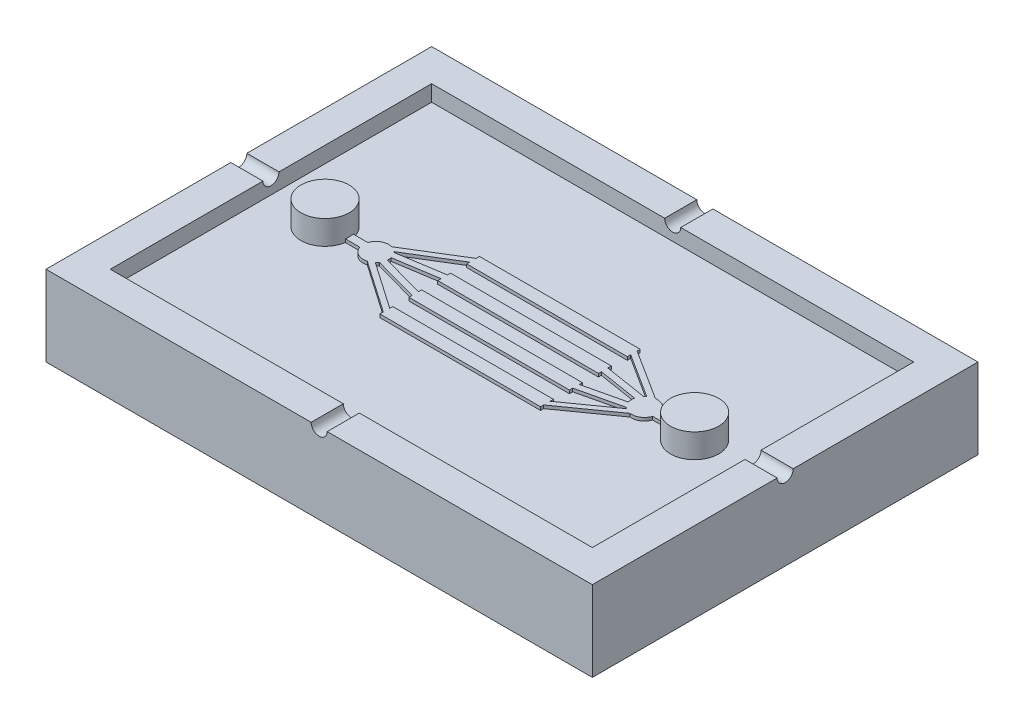
from build123d import *

# Parameters (mm, degrees)
CROQUIS1_W               = 34
CROQUIS1_H               = 24
SALIENTE_EXTRUIR1_DEPTH  = 3
CROQUIS2_W               = 30
CROQUIS2_H               = 20
CORTAR_EXTRUIR1_DEPTH    = 1
CROQUIS6_R               = 1.5
SALIENTE_EXTRUIR3_DEPTH  = 1.5
MATRIZL1_COUNT           = 2
MATRIZL1_PITCH           = 23
CROQUIS8_W               = 3
CROQUIS8_H               = 0.5
SALIENTE_EXTRUIR5_DEPTH  = 0.2
CROQUIS10_W              = 3
CROQUIS10_H              = 0.5
SALIENTE_EXTRUIR6_DEPTH  = 0.2
CROQUIS15_R              = 0.5
CORTAR_EXTRUIR2_DEPTH    = 2
MATRIZL2_COUNT           = 2
MATRIZL2_PITCH           = 22
CROQUIS17_R              = 0.5
CORTAR_EXTRUIR4_DEPTH    = 2
MATRIZL3_COUNT           = 2
MATRIZL3_PITCH           = 32
CROQUIS18_W              = 10
CROQUIS18_H              = 0.8
SALIENTE_EXTRUIR8_DEPTH  = 0.2
CROQUIS23_W              = 34
CROQUIS23_H              = 24
SALIENTE_EXTRUIR11_DEPTH = 2
CROQUIS24_W              = 30
CROQUIS24_H              = 20
CORTAR_EXTRUIR6_DEPTH    = 2
SALIENTE_EXTRUIR15_DEPTH = 0.2
CORTAR_EXTRUIR5_DEPTH    = 3


with BuildPart() as part:
    # Croquis1 → Saliente-Extruir1 (new body)
    with BuildSketch(Plane(origin=(0, 0, 0), x_dir=(1, 0, 0), z_dir=(0, 1, 0))):
        Rectangle(CROQUIS1_W, CROQUIS1_H)
    extrude(amount=SALIENTE_EXTRUIR1_DEPTH)

    # Croquis2 → Cortar-Extruir1 (cut)
    with BuildSketch(Plane(origin=(0, 3, 0), x_dir=(1, 0, 0), z_dir=(0, 1, 0))):
        Rectangle(CROQUIS2_W, CROQUIS2_H)
    extrude(amount=-CORTAR_EXTRUIR1_DEPTH, mode=Mode.SUBTRACT)

    # Croquis6 → Saliente-Extruir3 (add)
    with BuildSketch(Plane(origin=(-1.755264317, 2, -0.109917309), x_dir=(1, 0, 0), z_dir=(0, 1, 0))):
        with Locations((-9.854739848, -0.135008356)):
            Circle(CROQUIS6_R)
    saliente_extruir3 = extrude(amount=SALIENTE_EXTRUIR3_DEPTH)

    # MatrizL1: Saliente-Extruir3 ×2
    with Locations(*[(i * MATRIZL1_PITCH, 0, 0) for i in range(1, MATRIZL1_COUNT)]):
        add(saliente_extruir3)

    # Croquis8 → Saliente-Extruir5 (add)
    with BuildSketch(Plane(origin=(0, 2, 0.512947444), x_dir=(1, 0, 0), z_dir=(0, 1, 0))):
        with Locations((-10.126974046, 0.515237611)):
            Rectangle(CROQUIS8_W, CROQUIS8_H)
    extrude(amount=SALIENTE_EXTRUIR5_DEPTH)

    # Croquis10 → Saliente-Extruir6 (add)
    with BuildSketch(Plane(origin=(3.639202125, 2, -0.512947444), x_dir=(1, 0, 0), z_dir=(0, 1, 0))):
        with Locations((6.49596321, -0.510747589)):
            Rectangle(CROQUIS10_W, CROQUIS10_H)
    extrude(amount=SALIENTE_EXTRUIR6_DEPTH)

    # Croquis15 → Cortar-Extruir2 (cut)
    with BuildSketch(Plane.XY.offset(12)):
        with Locations((0, 3)):
            Circle(CROQUIS15_R)
    cortar_extruir2 = extrude(amount=-CORTAR_EXTRUIR2_DEPTH, mode=Mode.SUBTRACT)

    # MatrizL2: Cortar-Extruir2 ×2
    with Locations(*[(0, 0, -i * MATRIZL2_PITCH) for i in range(1, MATRIZL2_COUNT)]):
        add(cortar_extruir2, mode=Mode.SUBTRACT)

    # Croquis17 → Cortar-Extruir4 (cut)
    with BuildSketch(Plane(origin=(17, 0, 0), x_dir=(0, 0, -1), z_dir=(1, 0, 0))):
        with Locations((0, 3)):
            Circle(CROQUIS17_R)
    cortar_extruir4 = extrude(amount=-CORTAR_EXTRUIR4_DEPTH, mode=Mode.SUBTRACT)

    # MatrizL3: Cortar-Extruir4 ×2
    with Locations(*[(-i * MATRIZL3_PITCH, 0, 0) for i in range(1, MATRIZL3_COUNT)]):
        add(cortar_extruir4, mode=Mode.SUBTRACT)

    # Croquis18 → Saliente-Extruir8 (add)
    with BuildSketch(Plane(origin=(0, 2, 0), x_dir=(1, 0, 0), z_dir=(0, 1, 0))):
        with Locations((0, -1.022569438)):
            Rectangle(CROQUIS18_W, CROQUIS18_H)
        with Locations((0, 2.577430562)):
            Rectangle(CROQUIS18_W, CROQUIS18_H)
        with Locations((0, 0.777430562)):
            Rectangle(CROQUIS18_W, CROQUIS18_H)
        with Locations((0, -2.822569438)):
            Rectangle(CROQUIS18_W, CROQUIS18_H)
    extrude(amount=SALIENTE_EXTRUIR8_DEPTH)

    # Croquis23 → Saliente-Extruir11 (add)
    with BuildSketch(Plane.XZ):
        Rectangle(CROQUIS23_W, CROQUIS23_H)
    extrude(amount=SALIENTE_EXTRUIR11_DEPTH)

    # Croquis24 → Cortar-Extruir6 (cut)
    with BuildSketch(Plane.XZ.offset(2)):
        Rectangle(CROQUIS24_W, CROQUIS24_H)
    extrude(amount=-CORTAR_EXTRUIR6_DEPTH, mode=Mode.SUBTRACT)

    # Croquis27 → Saliente-Extruir15 (add)
    with BuildSketch(Plane(origin=(0, 2, 0), x_dir=(1, 0, 0), z_dir=(0, 1, 0))):
        with BuildLine():
            Line((-5, 0.583746096), (-5, 0.983746096))
            Line((-5, 0.983746096), (-7.8660853, 0.531918182))
            ThreePointArc((-7.8660853, 0.531918182), (-7.888838007, 0.556426917), (-7.912595135, 0.579963327))
            Line((-7.912595135, 0.579963327), (-5, 2.366376735))
            Line((-5, 2.366376735), (-5, 2.766376735))
            Line((-5, 2.766376735), (-8.252330095, 0.771590018))
            ThreePointArc((-8.252330095, 0.771590018), (-9.263604295, -0.00675655), (-8.239327487, -0.767910876))
            Line((-8.239327487, -0.767910876), (-5, -3.009506141))
            Line((-5, -3.009506141), (-5, -2.609506141))
            Line((-5, -2.609506141), (-7.921221033, -0.588038642))
            ThreePointArc((-7.921221033, -0.588038642), (-7.858611749, -0.523401848), (-7.803657719, -0.452142517))
            Line((-7.803657719, -0.452142517), (-5, -1.225529167))
            Line((-5, -1.225529167), (-5, -0.825529167))
            Line((-5, -0.825529167), (-7.66864222, -0.08938643))
            ThreePointArc((-7.66864222, -0.08938643), (-7.664460433, 0.036379703), (-7.680051428, 0.161245745))
            Line((-7.680051428, 0.161245745), (-5, 0.583746096))
        make_face()
        with BuildLine():
            Line((7.651341848, 0.53758298), (5, 0.959719389))
            Line((5, 0.959719389), (5, 0.559719389))
            Line((5, 0.559719389), (7.461592898, 0.167794075))
            ThreePointArc((7.461592898, 0.167794075), (7.44459995, -0.035807033), (7.479732426, -0.23707273))
            Line((7.479732426, -0.23707273), (5, -0.820212362))
            Line((5, -0.820212362), (5, -1.220212362))
            Line((5, -1.220212362), (7.698726192, -0.585573648))
            ThreePointArc((7.698726192, -0.585573648), (7.738674858, -0.62036312), (7.780838334, -0.65243249))
            Line((7.780838334, -0.65243249), (5, -2.629310105))
            Line((5, -2.629310105), (5, -3.029310105))
            Line((5, -3.029310105), (8.144613144, -0.793827641))
            ThreePointArc((8.144613144, -0.793827641), (8.6726594, -0.675335531), (9.00445259, -0.247800145))
            Line((9.00445259, -0.247800145), (8.635165335, -0.247800145))
            Line((8.635165335, -0.247800145), (8.635165335, 0.252199855))
            Line((8.635165335, 0.252199855), (9.003005185, 0.252199855))
            ThreePointArc((9.003005185, 0.252199855), (8.665774703, 0.679658619), (8.133086427, 0.792302279))
            Line((8.133086427, 0.792302279), (5, 2.78553273))
            Line((5, 2.78553273), (5, 2.38553273))
            Line((5, 2.38553273), (7.754666495, 0.633048313))
            ThreePointArc((7.754666495, 0.633048313), (7.700901719, 0.587591186), (7.651341848, 0.53758298))
        make_face()
    extrude(amount=SALIENTE_EXTRUIR15_DEPTH)

    # Croquis20 → Cortar-Extruir5 (cut)
    with BuildSketch(Plane.XZ.offset(3)):
        Polygon((-11.577956595, 6.445978915), (-10.077956595, 7.312004318), (-10.077956595, 9.044055126), (-11.577956595, 9.91008053), (-13.077956595, 9.044055126), (-13.077956595, 7.312004318), align=None)
        Polygon((-3.206073137, 7.302645855), (-3.195247381, 9.03466283), (-4.689805203, 9.910046698), (-6.195188782, 9.05341359), (-6.206014538, 7.321396614), (-4.711456715, 6.446012747), align=None)
        Polygon((-3.214769909, 2.447257346), (-3.191141961, 4.179146985), (-4.67918841, 5.065554207), (-6.190862808, 4.220071791), (-6.214490756, 2.488182153), (-4.726444306, 1.60177493), align=None)
        Polygon((-10.042152784, 2.467156999), (-10.041595975, 4.199207717), (-11.541317492, 5.065715287), (-13.04159582, 4.200172139), (-13.042152629, 2.468121421), (-11.542431111, 1.601613851), align=None)
    extrude(amount=-CORTAR_EXTRUIR5_DEPTH, mode=Mode.SUBTRACT)


solid = part.part
